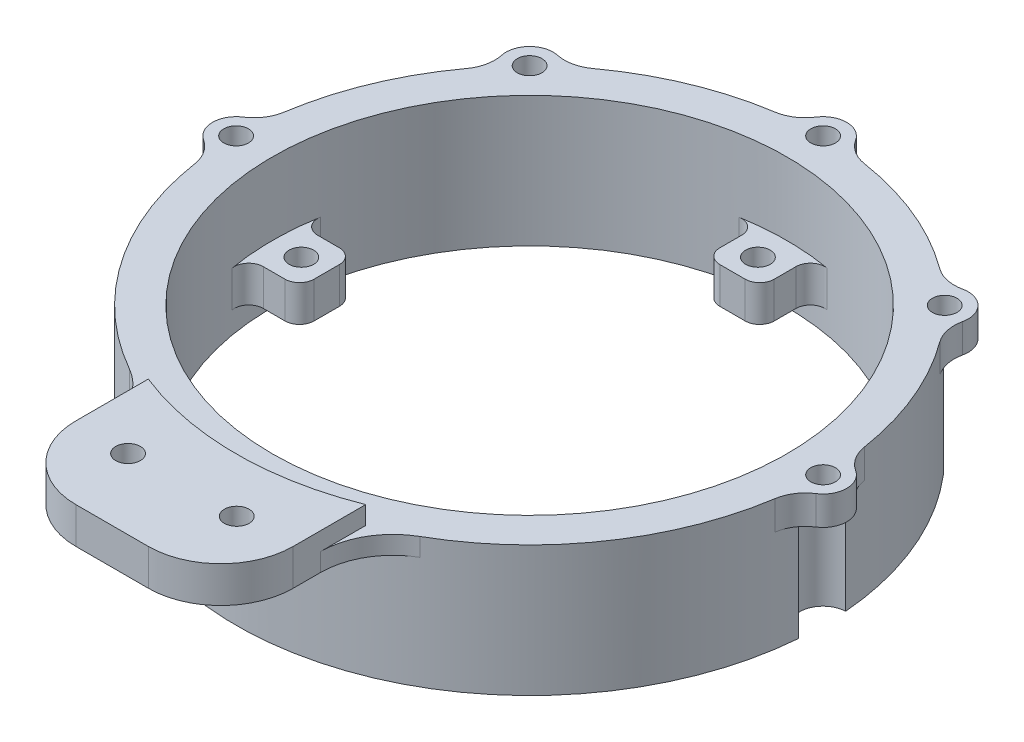
from build123d import *

# Parameters (mm, degrees)
CROQUIS1_R                                           = 40.5
CROQUIS1_R_2                                         = 35.5
SALIENTE_EXTRUIR1_DEPTH                              = 9
CROQUIS2_R                                           = 1.7
SALIENTE_EXTRUIR2_DEPTH                              = 2.5
REDONDEO1_R                                          = 10
CROQUIS4_R                                           = 1.7
SALIENTE_EXTRUIR3_DEPTH                              = 5
REDONDEO2_R                                          = 2
MATRIZC1_COUNT                                       = 4
REDONDEO2_OF_MATRIZC1_R                              = 2
REFRENTADO_PARA_TORNILLO_CON_CABEZA_PLAN_D           = 3.4
REFRENTADO_PARA_TORNILLO_CON_CABEZA_PLAN_CBORE_D     = 6.5
REFRENTADO_PARA_TORNILLO_CON_CABEZA_PLAN_CBORE_DEPTH = 14
CROQUIS8_R                                           = 3.25
CROQUIS8_R_2                                         = 1.7
SALIENTE_EXTRUIR4_DEPTH                              = 4
MATRIZC2_COUNT                                       = 3
MATRIZC2_ANGLE                                       = 90
SIMETR_A1_COPY_1_D                                   = 3.4
SIMETR_A1_COPY_1_CBORE_D                             = 6.5
SIMETR_A1_COPY_1_CBORE_DEPTH                         = 14
SIMETR_A1_COPY_2_D                                   = 3.4
SIMETR_A1_COPY_2_CBORE_D                             = 6.5
SIMETR_A1_COPY_2_CBORE_DEPTH                         = 14
SIMETR_A1_COPY_3_SKETCH_R                            = 3.25
SIMETR_A1_COPY_3_SKETCH_R_2                          = 1.7
SIMETR_A1_COPY_3_DEPTH                               = 4
SIMETR_A1_COPY_4_SKETCH_R                            = 3.25
SIMETR_A1_COPY_4_SKETCH_R_2                          = 1.7
SIMETR_A1_COPY_4_DEPTH                               = 4
SIMETR_A1_COPY_5_D                                   = 3.4
SIMETR_A1_COPY_5_CBORE_D                             = 6.5
SIMETR_A1_COPY_5_CBORE_DEPTH                         = 14
SIMETR_A1_COPY_6_SKETCH_R                            = 3.25
SIMETR_A1_COPY_6_SKETCH_R_2                          = 1.7
SIMETR_A1_COPY_6_DEPTH                               = 4
REDONDEO4_R                                          = 5


with BuildPart() as part:
    # Croquis1 → Saliente-Extruir1 (new, symmetric)
    with BuildSketch(Plane(origin=(0, 0, 0), x_dir=(1, 0, 0), z_dir=(0, 1, 0))):
        with Locations(Location((0, 0, 0), (0, 0, 270))):
            Circle(CROQUIS1_R)
        with Locations(Location((0, 0, 0), (0, 0, 270))):
            Circle(CROQUIS1_R_2, mode=Mode.SUBTRACT)
    extrude(amount=SALIENTE_EXTRUIR1_DEPTH, both=True)

    # Croquis2 → Saliente-Extruir2 (add, symmetric)
    with BuildSketch(Plane.XZ.offset(-9)):
        with BuildLine():
            Line((-15, 37.619808612), (-15, 57.619808612))
            Line((-15, 57.619808612), (15, 57.619808612))
            Line((15, 57.619808612), (15, 37.619808612))
            ThreePointArc((15, 37.619808612), (0, 40.5), (-15, 37.619808612))
        make_face()
        with Locations(Location((-7.5, 47.916594203, 0), (0, 0, 270))):
            Circle(CROQUIS2_R, mode=Mode.SUBTRACT)
        with Locations(Location((7.5, 47.916594203, 0), (0, 0, 90))):
            Circle(CROQUIS2_R, mode=Mode.SUBTRACT)
    extrude(amount=SALIENTE_EXTRUIR2_DEPTH, both=True)

    # Redondeo1
    redondeo1_edges = [part.edges().sort_by_distance(p)[0] for p in [
        (-15, 7.75, 37.619808612),
        (15, 7.75, 37.619808612),
        (15, 9, 57.619808612),
        (-15, 9, 57.619808612),
    ]]
    fillet(redondeo1_edges, radius=REDONDEO1_R)

    # Croquis4 → Saliente-Extruir3 (add)
    with BuildSketch(Plane(origin=(0, -6, 0), x_dir=(-1, 0, 0), z_dir=(0, -1, 0))):
        with BuildLine():
            Line((-3.75, -35.301380993), (-3.75, -28))
            Line((-3.75, -28), (3.75, -28))
            Line((3.75, -28), (3.75, -35.301380993))
            ThreePointArc((3.75, -35.301380993), (0, -35.5), (-3.75, -35.301380993))
        make_face()
        with Locations(Location((0, -31.5, 0), (0, 0, 90))):
            Circle(CROQUIS4_R, mode=Mode.SUBTRACT)
    saliente_extruir3 = extrude(amount=-SALIENTE_EXTRUIR3_DEPTH)

    # Redondeo2
    redondeo2_edges = [part.edges().sort_by_distance(p)[0] for p in [
        (-3.75, -3.5, 35.301380993),
        (3.75, -3.5, 35.301380993),
        (3.75, -3.5, 28),
        (-3.75, -3.5, 28),
    ]]
    fillet(redondeo2_edges, radius=REDONDEO2_R)

    # MatrizC1: Saliente-Extruir3 ×4 about axis
    matrizc1_axis = Axis((0, 0, 0), (0, 1, 0))
    for i in range(1, MATRIZC1_COUNT):
        add(saliente_extruir3.rotate(matrizc1_axis, i * 360 / MATRIZC1_COUNT))

    # Redondeo2 of MatrizC1
    redondeo2_of_matrizc1_edges = [part.edges().sort_by_distance(p)[0] for p in [
        (35.301380993, -3.5, 3.75),
        (35.301380993, -3.5, -3.75),
        (28, -3.5, -3.75),
        (28, -3.5, 3.75),
        (3.75, -3.5, -35.301380993),
        (-3.75, -3.5, -35.301380993),
        (-3.75, -3.5, -28),
        (3.75, -3.5, -28),
        (-35.301380993, -3.5, -3.75),
        (-35.301380993, -3.5, 3.75),
        (-28, -3.5, 3.75),
        (-28, -3.5, -3.75),
    ]]
    fillet(redondeo2_of_matrizc1_edges, radius=REDONDEO2_OF_MATRIZC1_R)

    # Refrentado para tornillo con cabeza plana de M31 (through all)
    with Locations(Plane(origin=(0, -9, 0), x_dir=(-1, 0, 0), z_dir=(0, -1, 0))):
        with Locations((0, 40.5)):
            refrentado_para_tornillo_con_cabeza_plan = CounterBoreHole(REFRENTADO_PARA_TORNILLO_CON_CABEZA_PLAN_D / 2, REFRENTADO_PARA_TORNILLO_CON_CABEZA_PLAN_CBORE_D / 2, REFRENTADO_PARA_TORNILLO_CON_CABEZA_PLAN_CBORE_DEPTH)

    # Croquis8 → Saliente-Extruir4 (add)
    with BuildSketch(Plane.XZ.offset(-5)):
        with Locations((0, -40.5)):
            Circle(CROQUIS8_R)
        with Locations(Location((0, -40.5, 0), (0, 0, 270))):
            Circle(CROQUIS8_R_2, mode=Mode.SUBTRACT)
    saliente_extruir4 = extrude(amount=-SALIENTE_EXTRUIR4_DEPTH)

    # MatrizC2: Refrentado para tornillo con cabeza plana de M31, Saliente-Extruir4 ×3 about axis
    matrizc2_axis = Axis((0, 0, 0), (0, 1, 0))
    add([refrentado_para_tornillo_con_cabeza_plan.rotate(matrizc2_axis, i * MATRIZC2_ANGLE / (MATRIZC2_COUNT - 1)) for i in range(1, MATRIZC2_COUNT)], mode=Mode.SUBTRACT)
    add([saliente_extruir4.rotate(matrizc2_axis, i * MATRIZC2_ANGLE / (MATRIZC2_COUNT - 1)) for i in range(1, MATRIZC2_COUNT)])

    # Simetría1 copy 1 (through all)
    with Locations(Plane(origin=(0, -9, 0), x_dir=(0.7071067811865467, 0, 0.7071067811865483), z_dir=(0, -1, 0))):
        with Locations((0, -40.5)):
            CounterBoreHole(SIMETR_A1_COPY_1_D / 2, SIMETR_A1_COPY_1_CBORE_D / 2, SIMETR_A1_COPY_1_CBORE_DEPTH)

    # Simetría1 copy 2 (through all)
    with Locations(Plane(origin=(0, -9, 0), x_dir=(0, 0, 1), z_dir=(0, -1, 0))):
        with Locations((0, -40.5)):
            CounterBoreHole(SIMETR_A1_COPY_2_D / 2, SIMETR_A1_COPY_2_CBORE_D / 2, SIMETR_A1_COPY_2_CBORE_DEPTH)

    # Simetría1 copy 3 sketch → Simetría1 copy 3 (add)
    with BuildSketch(Plane(origin=(0, 5, 0), x_dir=(-0.7071067811865467, 0, -0.7071067811865483), z_dir=(0, -1, 0))):
        with Locations((0, 40.5)):
            Circle(SIMETR_A1_COPY_3_SKETCH_R)
        with Locations((0, 40.5)):
            Circle(SIMETR_A1_COPY_3_SKETCH_R_2, mode=Mode.SUBTRACT)
    extrude(amount=-SIMETR_A1_COPY_3_DEPTH)

    # Simetría1 copy 4 sketch → Simetría1 copy 4 (add)
    with BuildSketch(Plane(origin=(0, 5, 0), x_dir=(0, 0, -1), z_dir=(0, -1, 0))):
        with Locations((0, 40.5)):
            Circle(SIMETR_A1_COPY_4_SKETCH_R)
        with Locations((0, 40.5)):
            Circle(SIMETR_A1_COPY_4_SKETCH_R_2, mode=Mode.SUBTRACT)
    extrude(amount=-SIMETR_A1_COPY_4_DEPTH)

    # Simetría1 copy 5 (through all)
    with Locations(Plane.XZ.offset(9)):
        with Locations((0, -40.5)):
            CounterBoreHole(SIMETR_A1_COPY_5_D / 2, SIMETR_A1_COPY_5_CBORE_D / 2, SIMETR_A1_COPY_5_CBORE_DEPTH)

    # Simetría1 copy 6 sketch → Simetría1 copy 6 (add)
    with BuildSketch(Plane(origin=(0, 5, 0), x_dir=(-1, 0, 0), z_dir=(0, -1, 0))):
        with Locations((0, 40.5)):
            Circle(SIMETR_A1_COPY_6_SKETCH_R)
        with Locations((0, 40.5)):
            Circle(SIMETR_A1_COPY_6_SKETCH_R_2, mode=Mode.SUBTRACT)
    extrude(amount=-SIMETR_A1_COPY_6_DEPTH)

    # Redondeo4
    # the kernel refuses this fillet: 5 mm, written as the material it adds along each edge
    with BuildSketch(Plane(origin=(3.247382872, 5, -40.369598765), x_dir=(-0.26298456130180026, 0, -0.9648000417272481), z_dir=(0, 1, 0)), Plane(origin=(-26.249370591, 5, -30.841863491), x_dir=(-0.8681748186382738, 0, -0.4962584853505281), z_dir=(0, 1, 0)), Plane(origin=(-40.369598765, 5, -3.247382872), x_dir=(-0.9648000417272475, 0, 0.2629845613018025), z_dir=(0, 1, 0)), Plane(origin=(30.841863491, 5, -26.249370591), x_dir=(0.49625848535052886, 0, -0.8681748186382734), z_dir=(0, 1, 0)), Plane(origin=(40.369598765, 5, 3.247382872), x_dir=(0.9648000417272491, 0, -0.2629845613017969), z_dir=(0, 1, 0))) as redondeo4_piece_1:
        with BuildLine():
            CenterArc((3.467064855, -4.767356337), REDONDEO4_R, 107.546751442, 48.438780652)
            ThreePointArc((-1.100148756, -2.732519778), (-0.525223225, -1.376265293), (0, 0))
            ThreePointArc((0, 0), (0.979822677, -0.151218381), (1.959645353, 0))
        make_face()
    extrude(amount=4)
    with BuildSketch(Plane(origin=(-3.247382872, 5, -40.369598765), x_dir=(-0.9932049358227855, 0, 0.11637850083781144), z_dir=(0, 1, 0)), Plane(origin=(-30.841863491, 5, -26.249370591), x_dir=(-0.6200099181014976, 0, 0.7845939723549846), z_dir=(0, 1, 0)), Plane(origin=(26.249370591, 5, -30.841863491), x_dir=(-0.784593972354982, 0, -0.6200099181015007), z_dir=(0, 1, 0)), Plane(origin=(40.369598765, 5, -3.247382872), x_dir=(-0.1163785008378116, 0, -0.9932049358227855), z_dir=(0, 1, 0))) as redondeo4_piece_2:
        with BuildLine():
            CenterArc((3.127505063, -4.99669263), REDONDEO4_R, 92.084097226, 48.438780652)
            ThreePointArc((-0.731887458, -1.817842308), (-0.22566775, -0.965398127), (0, 0))
            ThreePointArc((0, 0), (1.472836687, -0.026789699), (2.945673373, 0))
        make_face()
    extrude(amount=4)
    with BuildSketch(Plane(origin=(-40.369598765, 5, 3.247382872), x_dir=(-0.9648000417272488, 0, -0.262984561301798), z_dir=(0, 1, 0))) as redondeo4_piece_3:
        with BuildLine():
            CenterArc((3.467064855, 4.767356337), REDONDEO4_R, 204.014467906, 48.438780652)
            ThreePointArc((-1.100148756, 2.732519778), (-0.525223225, 1.376265293), (0, 0))
            ThreePointArc((0, 0), (0.979822677, 0.151218381), (1.959645353, 0))
        make_face()
    extrude(amount=4)


solid = part.part
